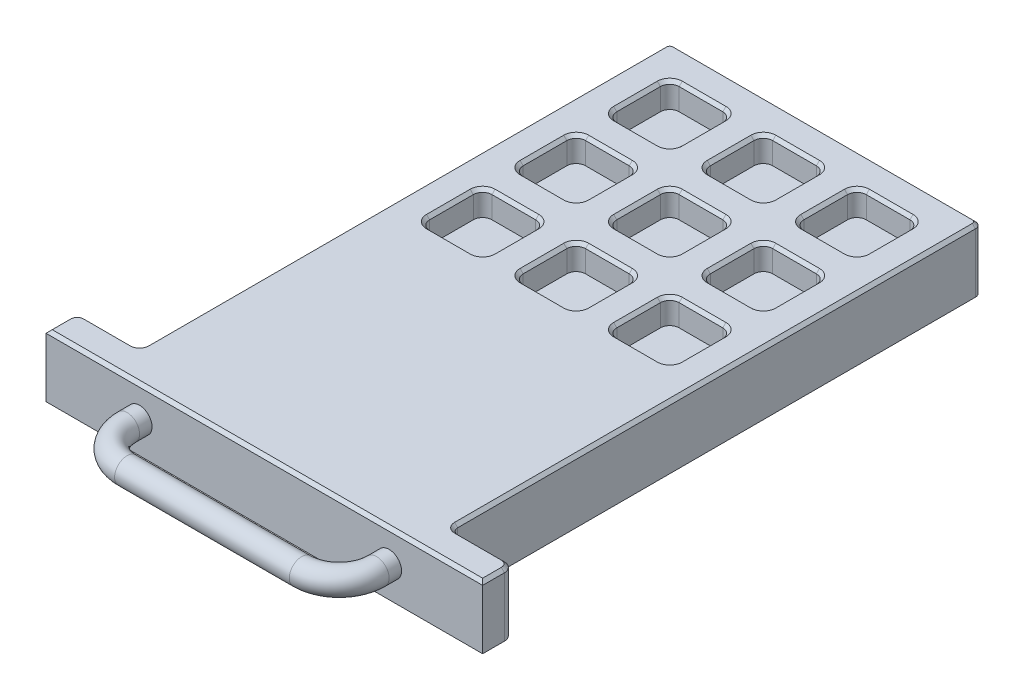
from build123d import *

# Parameters (mm, degrees)
EXTRUDE_1_DEPTH             = 20
CUT_EXTRUDE_3_DEPTH         = 8
PATTERN_LINEAR_3_COUNT      = 3
PATTERN_LINEAR_3_PITCH      = 30
PATTERN_LINEAR_3_COUNT_DIR2 = 3
PATTERN_LINEAR_3_PITCH_DIR2 = 30
CHAMFER_3_SIZE              = 1
SKETCH_5_R                  = 4


with BuildPart() as part:
    # 草图1 → 凸台-拉伸1 (new body)
    with BuildSketch(Plane(origin=(0, 0, 0), x_dir=(1, 0, 0), z_dir=(0, 1, 0))):
        with BuildLine():
            Line((-48, 180), (48, 180))
            ThreePointArc((48, 180), (49.414213562, 179.414213562), (50, 178))
            Line((50, 178), (50, 12))
            ThreePointArc((50, 12), (50.585786438, 10.585786438), (52, 10))
            Line((52, 10), (67, 10))
            ThreePointArc((67, 10), (69.121320344, 9.121320344), (70, 7))
            Line((70, 7), (70, 0))
            Line((70, 0), (-70, 0))
            Line((-70, 0), (-70, 7))
            ThreePointArc((-70, 7), (-69.121320344, 9.121320344), (-67, 10))
            Line((-67, 10), (-52, 10))
            ThreePointArc((-52, 10), (-50.585786438, 10.585786438), (-50, 12))
            Line((-50, 12), (-50, 178))
            ThreePointArc((-50, 178), (-49.414213562, 179.414213562), (-48, 180))
        make_face()
    extrude(amount=EXTRUDE_1_DEPTH)

    # 草图3 → 切除-拉伸3 (cut)
    with BuildSketch(Plane(origin=(0, 20, 0), x_dir=(1, 0, 0), z_dir=(0, 1, 0))):
        with BuildLine():
            Line((-37, 170), (-23, 170))
            ThreePointArc((-23, 170), (-20.878679656, 169.121320344), (-20, 167))
            Line((-20, 167), (-20, 153))
            ThreePointArc((-20, 153), (-20.878679656, 150.878679656), (-23, 150))
            Line((-23, 150), (-37, 150))
            ThreePointArc((-37, 150), (-39.121320344, 150.878679656), (-40, 153))
            Line((-40, 153), (-40, 167))
            ThreePointArc((-40, 167), (-39.121320344, 169.121320344), (-37, 170))
        make_face()
    cut_extrude_3 = extrude(amount=-CUT_EXTRUDE_3_DEPTH, mode=Mode.SUBTRACT)

    # 阵列(线性)3: Cut-Extrude 3 3 × 3
    with Locations(*[(i * PATTERN_LINEAR_3_PITCH, 0, j * PATTERN_LINEAR_3_PITCH_DIR2) for i in range(PATTERN_LINEAR_3_COUNT) for j in range(PATTERN_LINEAR_3_COUNT_DIR2) if (i, j) != (0, 0)]):
        add(cut_extrude_3, mode=Mode.SUBTRACT)

    # 倒角3
    chamfer_3_edges = [part.edges().sort_by_distance(p)[0] for p in [
        (40, 20, -100),
        (39.121320344, 20, -109.121320344),
        (30, 20, -110),
        (20.878679656, 20, -109.121320344),
        (20, 20, -100),
        (20.878679656, 20, -90.878679656),
        (30, 20, -90),
        (39.121320344, 20, -90.878679656),
        (10, 20, -100),
        (9.121320344, 20, -109.121320344),
        (0, 20, -110),
        (-9.121320344, 20, -109.121320344),
        (-10, 20, -100),
        (-9.121320344, 20, -90.878679656),
        (0, 20, -90),
        (9.121320344, 20, -90.878679656),
        (-20, 20, -100),
        (-20.878679656, 20, -109.121320344),
        (-30, 20, -110),
        (-39.121320344, 20, -109.121320344),
        (-40, 20, -100),
        (-39.121320344, 20, -90.878679656),
        (-30, 20, -90),
        (-20.878679656, 20, -90.878679656),
        (40, 20, -130),
        (39.121320344, 20, -139.121320344),
        (30, 20, -140),
        (20.878679656, 20, -139.121320344),
        (20, 20, -130),
        (20.878679656, 20, -120.878679656),
        (30, 20, -120),
        (39.121320344, 20, -120.878679656),
        (10, 20, -130),
        (9.121320344, 20, -139.121320344),
        (0, 20, -140),
        (-9.121320344, 20, -139.121320344),
        (-10, 20, -130),
        (-9.121320344, 20, -120.878679656),
        (0, 20, -120),
        (9.121320344, 20, -120.878679656),
        (-20, 20, -130),
        (-20.878679656, 20, -139.121320344),
        (-30, 20, -140),
        (-39.121320344, 20, -139.121320344),
        (-40, 20, -130),
        (-39.121320344, 20, -120.878679656),
        (-30, 20, -120),
        (-20.878679656, 20, -120.878679656),
        (40, 20, -160),
        (39.121320344, 20, -169.121320344),
        (30, 20, -170),
        (20.878679656, 20, -169.121320344),
        (20, 20, -160),
        (20.878679656, 20, -150.878679656),
        (30, 20, -150),
        (39.121320344, 20, -150.878679656),
        (59.5, 20, -10),
        (69.121320344, 20, -9.121320344),
        (70, 20, -3.5),
        (0, 20, 0),
        (-70, 20, -3.5),
        (-69.121320344, 20, -9.121320344),
        (-59.5, 20, -10),
        (-50.585786438, 20, -10.585786438),
        (-50, 20, -95),
        (-49.414213562, 20, -179.414213562),
        (49.414213562, 20, -179.414213562),
        (50, 20, -95),
        (50.585786438, 20, -10.585786438),
        (-20.878679656, 20, -169.121320344),
        (-30, 20, -170),
        (-39.121320344, 20, -169.121320344),
        (-40, 20, -160),
        (-39.121320344, 20, -150.878679656),
        (-30, 20, -150),
        (-20.878679656, 20, -150.878679656),
        (-20, 20, -160),
        (9.121320344, 20, -169.121320344),
        (0, 20, -170),
        (-9.121320344, 20, -169.121320344),
        (-10, 20, -160),
        (-9.121320344, 20, -150.878679656),
        (0, 20, -150),
        (9.121320344, 20, -150.878679656),
        (10, 20, -160),
        (0, 20, -180),
    ]]
    chamfer(chamfer_3_edges, length=CHAMFER_3_SIZE)

    # 扫描1: sweep along a path in 草图4
    with BuildLine(Plane(origin=(0, 10, 0), x_dir=(-1, 0, 0), z_dir=(0, -1, 0))) as sweep_1_path:
        Line((-40, 0), (-40, -4))
        ThreePointArc((-40, -4), (-36.485281374, -12.485281374), (-28, -16))
        Line((-28, -16), (28, -16))
        ThreePointArc((28, -16), (36.485281374, -12.485281374), (40, -4))
        Line((40, -4), (40, 0))
    # 草图5 → 扫描1 (sweep)
    with BuildSketch(Plane.XY):
        with Locations((-40, 10)):
            Circle(SKETCH_5_R)
    sweep(path=sweep_1_path.line)


solid = part.part
